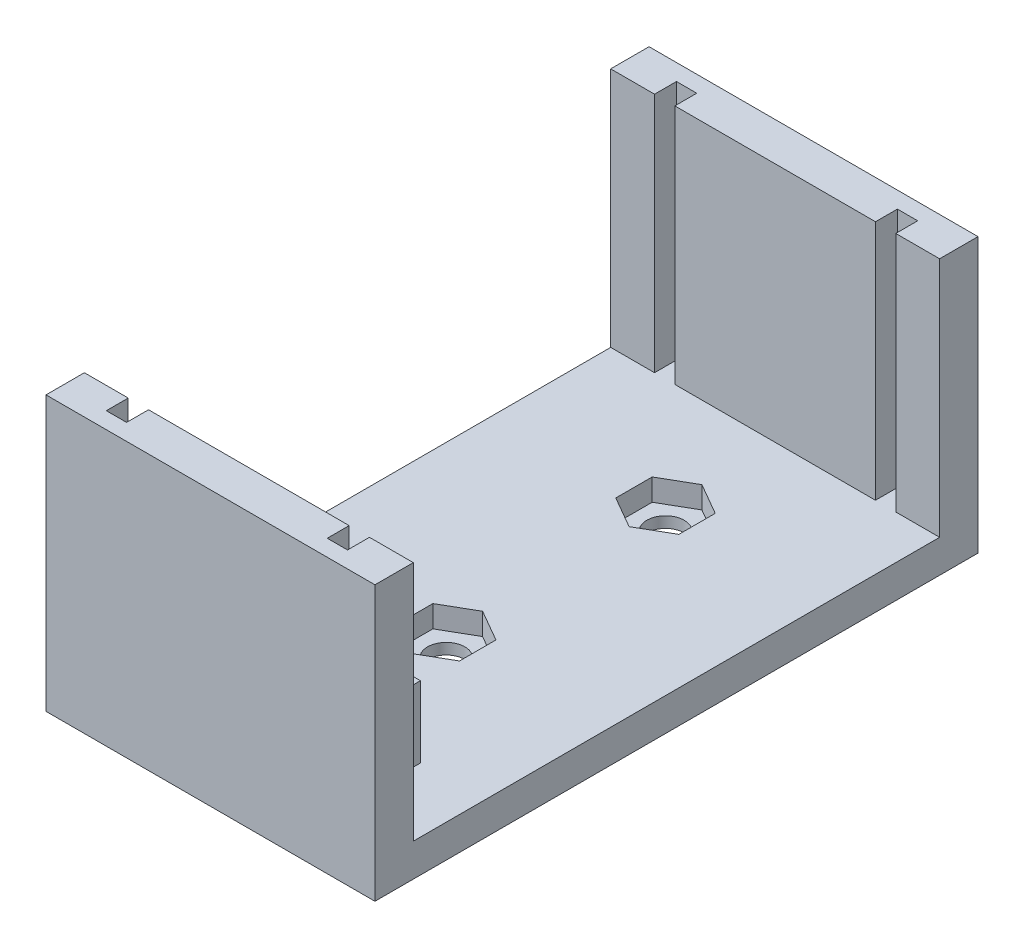
from build123d import *

# Parameters (mm, degrees)
BOSS_EXTRUDE1_DEPTH   = 25
BOSS_EXTRUDE1_2_DEPTH = 25
BOSS_EXTRUDE2_DEPTH   = 3
SKETCH2_W             = 18.3
SKETCH2_H             = 6.5
BOSS_EXTRUDE3_DEPTH   = 6.5
CUT_EXTRUDE1_REACH    = 46.322
SKETCH3_R             = 1.6
CUT_EXTRUDE2_REACH    = 40.279
SKETCH4_R             = 1.7
SKETCH4_3_R           = 1.7
CUT_EXTRUDE3_DEPTH    = 2


with BuildPart() as part:
    # Sketch1 → Boss-Extrude1 (new body)
    with BuildSketch(Plane(origin=(0, 0, 0), x_dir=(1, 0, 0), z_dir=(0, 1, 0))):
        Polygon((15, 27.5), (-15, 27.5), (-15, 24), (-11, 24), (-11, 26), (-9.15, 26), (-9.15, 24), (9.15, 24), (9.15, 26), (11, 26), (11, 24), (15, 24), align=None)
    extrude(amount=BOSS_EXTRUDE1_DEPTH)



with BuildPart() as body_2:
    # Sketch1 → Boss-Extrude1 2 (new body)
    with BuildSketch(Plane(origin=(0, 0, 0), x_dir=(1, 0, 0), z_dir=(0, 1, 0))):
        Polygon((-11, -24), (-15, -24), (-15, -27.5), (15, -27.5), (15, -24), (11, -24), (11, -26), (9.15, -26), (9.15, -24), (-9.15, -24), (-9.15, -26), (-11, -26), align=None)
    extrude(amount=BOSS_EXTRUDE1_2_DEPTH)


with BuildPart() as part_1:
    add(part.part)

    add(body_2.part)  # Boss-Extrude2 merges body 2
    # Sketch1<3> → Boss-Extrude2 (add)
    with BuildSketch(Plane(origin=(0, 0, 0), x_dir=(1, 0, 0), z_dir=(0, 1, 0))):
        Polygon((-11, 24), (-15, 24), (-15, -24), (-11, -24), (-11, -26), (-9.15, -26), (-9.15, -24), (9.15, -24), (9.15, -26), (11, -26), (11, -24), (15, -24), (15, 24), (11, 24), (11, 26), (9.15, 26), (9.15, 24), (-9.15, 24), (-9.15, 26), (-11, 26), align=None)
    extrude(amount=BOSS_EXTRUDE2_DEPTH)

    # Sketch2 → Boss-Extrude3 (add)
    with BuildSketch(Plane(origin=(0, 3, 0), x_dir=(1, 0, 0), z_dir=(0, 1, 0))):
        with Locations((0, -20.75)):
            Rectangle(SKETCH2_W, SKETCH2_H)
    extrude(amount=BOSS_EXTRUDE3_DEPTH)

    # Sketch3 → Cut-Extrude1 (cut, up to next)
    with BuildSketch(Plane(origin=(9.15, 0, 0), x_dir=(0, 0, -1), z_dir=(1, 0, 0)), mode=Mode.PRIVATE) as cut_extrude1_sk1:
        with Locations((-20.75, 6.25)):
            Circle(SKETCH3_R)
    cut_extrude1_tool1 = extrude(cut_extrude1_sk1.sketch, amount=-CUT_EXTRUDE1_REACH, mode=Mode.PRIVATE) & part_1.part
    add(cut_extrude1_tool1.solids().sort_by_distance((9.15, 6.25, 20.75))[0], mode=Mode.SUBTRACT)

    # Sketch4 → Cut-Extrude2 (cut, up to next)
    with BuildSketch(Plane(origin=(0, 3, 0), x_dir=(1, 0, 0), z_dir=(0, 1, 0)), mode=Mode.PRIVATE) as cut_extrude2_sk1:
        with Locations((0, 14)):
            Circle(SKETCH4_R)
    cut_extrude2_tool1 = extrude(cut_extrude2_sk1.sketch, amount=-CUT_EXTRUDE2_REACH, mode=Mode.PRIVATE) & part_1.part
    # Sketch4 → Cut-Extrude2 (cut, up to next)
    with BuildSketch(Plane(origin=(0, 3, 0), x_dir=(1, 0, 0), z_dir=(0, 1, 0)), mode=Mode.PRIVATE) as cut_extrude2_sk2:
        with Locations((0, -6)):
            Circle(SKETCH4_R)
    cut_extrude2_tool2 = extrude(cut_extrude2_sk2.sketch, amount=-CUT_EXTRUDE2_REACH, mode=Mode.PRIVATE) & part_1.part
    add(cut_extrude2_tool1.solids().sort_by_distance((0, 3, -14))[0], mode=Mode.SUBTRACT)
    add(cut_extrude2_tool2.solids().sort_by_distance((0, 3, 6))[0], mode=Mode.SUBTRACT)

    # Sketch4<3> → Cut-Extrude3 (cut)
    # profile 1 of 2: a face of its own
    with BuildSketch(Plane(origin=(0, 3, 0), x_dir=(1, 0, 0), z_dir=(0, 1, 0))):
        Polygon((-2.875, 12.340117976), (0, 10.680235952), (2.875, 12.340117976), (2.875, 15.659882024), (0, 17.319764048), (-2.875, 15.659882024), align=None)
        with Locations((0, 14)):
            Circle(SKETCH4_3_R, mode=Mode.SUBTRACT)
    # profile 2 of 2: a face of its own
    with BuildSketch(Plane(origin=(0, 3, 0), x_dir=(1, 0, 0), z_dir=(0, 1, 0))):
        Polygon((0, -9.319764048), (2.875, -7.659882024), (2.875, -4.340117976), (0, -2.680235952), (-2.875, -4.340117976), (-2.875, -7.659882024), align=None)
        with Locations((0, -6)):
            Circle(SKETCH4_3_R, mode=Mode.SUBTRACT)
    extrude(amount=-CUT_EXTRUDE3_DEPTH, mode=Mode.SUBTRACT)


solid = part_1.part
